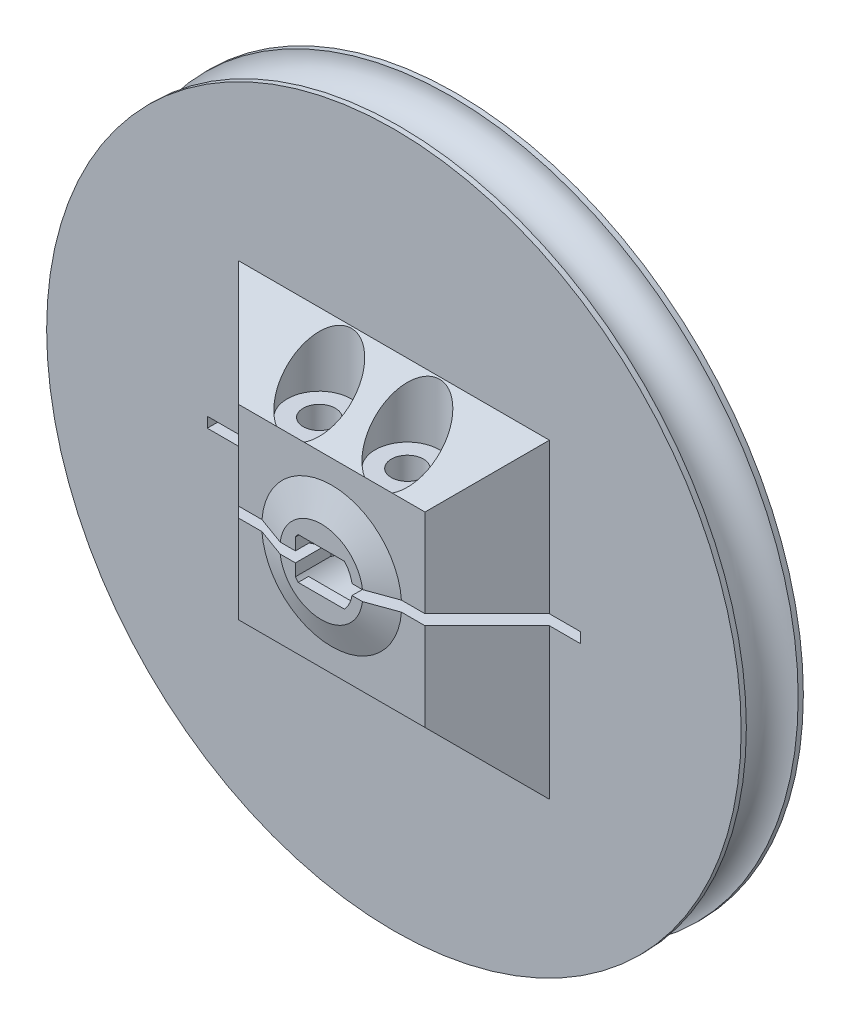
from build123d import *
from build123d.topology import SkipClean

# Parameters (mm, degrees)
SKETCH3_R               = 3
CUT_EXTRUDE1_DEPTH      = 48.754580932
SKETCH4_W               = 8
SKETCH4_H               = 1
BOSS_EXTRUDE1_DEPTH     = 6
BOSS_EXTRUDE2_START     = 6
SKETCH5_W               = 18
SKETCH5_H               = 18
BOSS_EXTRUDE2_DEPTH     = 6
BOSS_EXTRUDE3_START     = 1
SKETCH13_R              = 4
BOSS_EXTRUDE3_DEPTH     = 1
CHAMFER1_SIZE           = 6
CHAMFER2_SIZE2          = 1
CHAMFER2_SIZE           = 2.747477419
CUT_EXTRUDE2_DEPTH      = 49.872282533
CUT_EXTRUDE2_DEPTH_BACK = 49.872282533
SKETCH6_W               = 1
SKETCH6_H               = 36
CUT_EXTRUDE5_DEPTH      = 49.420037175
CUT_EXTRUDE5_DEPTH_BACK = 49.420037175
SKETCH7_R               = 1.55
CUT_EXTRUDE6_START      = 9
CUT_EXTRUDE6_DEPTH      = 40.420037195
CUT_EXTRUDE7_START      = 9
SKETCH9_R               = 3.1
CUT_EXTRUDE7_DEPTH      = 40.420037195
SKETCH11_R              = 2.5
BODY_MOVE_COPY1_ANGLE   = 180


with BuildPart() as part:
    # Sketch2 → Revolve1 (revolve)
    with BuildSketch(Plane(origin=(0, 0, 0), x_dir=(1, 0, 0), z_dir=(0, 1, 0))):
        with BuildLine():
            Line((0, 0), (0, 3))
            Line((0, 3), (33.5, 3))
            Line((33.5, 3), (33.5, 2.5))
            ThreePointArc((33.5, 2.5), (31, 0), (33.5, -2.5))
            Line((33.5, -2.5), (33.5, -3))
            Line((33.5, -3), (0, -3))
            Line((0, -3), (0, 0))
        make_face()
    revolve(axis=Axis((0, 0, 0), (0, 0, -1)))

    # Sketch3 → Cut-Extrude1 (cut, through all)
    with BuildSketch(Plane(origin=(0, 0, -3), x_dir=(-1, 0, 0), z_dir=(0, 0, -1))):
        Circle(SKETCH3_R)
    extrude(amount=-CUT_EXTRUDE1_DEPTH, mode=Mode.SUBTRACT)

    # Sketch4 → Boss-Extrude1 (add)
    with BuildSketch(Plane(origin=(0, 0, -3), x_dir=(-1, 0, 0), z_dir=(0, 0, -1))):
        with Locations((0, 3)):
            Rectangle(SKETCH4_W, SKETCH4_H)
    extrude(amount=-BOSS_EXTRUDE1_DEPTH)

    # Sketch5 → Boss-Extrude2 (add)
    with BuildSketch(Plane(origin=(0, 0, -3), x_dir=(-1, 0, 0), z_dir=(0, 0, -1)).offset(BOSS_EXTRUDE2_START)):
        Rectangle(SKETCH5_W, SKETCH5_H)
        with BuildLine():
            Line((-1.658312395, 2.5), (1.658312395, 2.5))
            ThreePointArc((1.658312395, 2.5), (0, -3), (-1.658312395, 2.5))
        make_face(mode=Mode.SUBTRACT)
    extrude(amount=-BOSS_EXTRUDE2_DEPTH)

    # Sketch13 → Boss-Extrude3 (add)
    with SkipClean():  # the faces are left unmerged after this step: merging them gives an invalid solid
        with BuildSketch(Plane(origin=(0, 0, -9), x_dir=(-1, 0, 0), z_dir=(0, 0, -1)).offset(BOSS_EXTRUDE3_START)):
            Circle(SKETCH13_R)
            with BuildLine():
                Line((1.658312395, 2.5), (-1.658312395, 2.5))
                ThreePointArc((-1.658312395, 2.5), (-1.833910419, 2.374188825), (-2, 2.236067977))
                Line((-2, 2.236067977), (-2, -2.236067977))
                ThreePointArc((-2, -2.236067977), (0, -3), (2, -2.236067977))
                Line((2, -2.236067977), (2, 2.236067977))
                ThreePointArc((2, 2.236067977), (1.833910419, 2.374188825), (1.658312395, 2.5))
            make_face(mode=Mode.SUBTRACT)
        extrude(amount=-BOSS_EXTRUDE3_DEPTH)

    # Chamfer1
    chamfer1_edges = [part.edges().sort_by_distance(p)[0] for p in [
        (0, -9, -3),
        (0, 9, -3),
        (9, 0, -3),
        (-9, 0, -3),
    ]]
    chamfer(chamfer1_edges, length=CHAMFER1_SIZE - 0.0001)  # a hair under: the kernel refuses the full size

    # Chamfer2
    chamfer2_edges = [part.edges().sort_by_distance(p)[0] for p in [
        (4, 0, -9),
    ]]
    chamfer2_side = [part.faces().sort_by_distance(p)[0] for p in [
        (4.02, 0, -9),
    ]]
    chamfer(chamfer2_edges, length=CHAMFER2_SIZE - 0.0001, length2=CHAMFER2_SIZE2 - 0.0001, reference=chamfer2_side[0])  # a hair under: the kernel refuses the full size

    # Sketch6 → Cut-Extrude2 (cut, two sides: drawn at the far end of the back side and taken through both)
    with BuildSketch(Plane(origin=(0, 0, -9), x_dir=(-1, 0, 0), z_dir=(0, 0, -1)).offset(-CUT_EXTRUDE2_DEPTH_BACK)):
        Rectangle(SKETCH6_W, SKETCH6_H)
    extrude(amount=CUT_EXTRUDE2_DEPTH + CUT_EXTRUDE2_DEPTH_BACK, mode=Mode.SUBTRACT)

    # Sketch7 → Cut-Extrude5 (cut, two sides: drawn at the far end of the back side and taken through both)
    with BuildSketch(Plane.ZY.offset(-CUT_EXTRUDE5_DEPTH_BACK)):
        with Locations((-6.2, 4)):
            Circle(SKETCH7_R)
        with Locations(Location((-6.2, -4.5, 0), (0, 0, 84.161721877))):
            Circle(SKETCH7_R)
    extrude(amount=CUT_EXTRUDE5_DEPTH + CUT_EXTRUDE5_DEPTH_BACK, mode=Mode.SUBTRACT)

    # Sketch8 → Cut-Extrude6 (cut, through all)
    with BuildSketch(Plane(origin=(0, 0, 0), x_dir=(0, 0, -1), z_dir=(1, 0, 0)).offset(CUT_EXTRUDE6_START)):
        Polygon((6.2, 7.233161507), (3.4, 5.616580754), (3.4, 2.383419246), (6.2, 0.766838493), (9, 2.383419246), (9, 5.616580754), align=None)
        Polygon((9, -2.883419246), (6.2, -1.266838493), (3.4, -2.883419246), (3.4, -6.116580754), (6.2, -7.733161507), (9, -6.116580754), align=None)
    extrude(amount=CUT_EXTRUDE6_DEPTH, mode=Mode.SUBTRACT)

    # Sketch9 → Cut-Extrude7 (cut, through all)
    with BuildSketch(Plane.ZY.offset(CUT_EXTRUDE7_START)):
        with Locations((-6.2, 4)):
            Circle(SKETCH9_R)
        with Locations((-6.2, -4.5)):
            Circle(SKETCH9_R)
    extrude(amount=CUT_EXTRUDE7_DEPTH, mode=Mode.SUBTRACT)


with BuildPart() as body_2:
    # Sketch11 → Revolve2 (revolve)
    with BuildSketch(Plane(origin=(0, 0, 0), x_dir=(1, 0, 0), z_dir=(0, 1, 0)), mode=Mode.PRIVATE) as revolve2_sk:
        with Locations((33.5, 0)):
            Circle(SKETCH11_R)
    revolve(revolve2_sk.sketch.rotate(Axis((0, 0, 0), (0, 0, 1)), 180), axis=Axis((0, 0, 0), (0, 0, 1)))


with BuildPart() as part_1:
    # Body-Move/Copy1: read off the stored shape, not the designer's step
    # Body-Move/Copy1: moved
    add(part.part.moved(Location((0.5, -8.5, -3))).rotate(Axis((0, 0, 0), (0.7071067812, -0.7071067812, 0)), BODY_MOVE_COPY1_ANGLE))


solid = part_1.part
